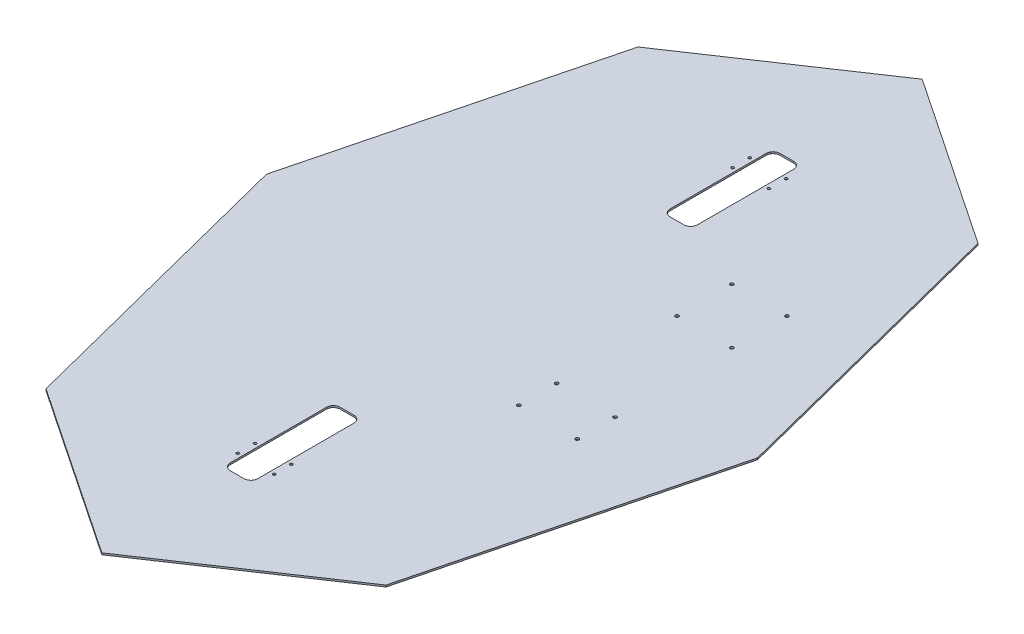
from build123d import *

# Parameters (mm, degrees)
BOSS_EXTRUDE1_DEPTH  = 1.5875
SKETCH2_W            = 50.8
SKETCH2_H            = 203.2
SKETCH2_R            = 2.54
CUT_EXTRUDE1_DEPTH   = 884.673339516
FILLET1_R            = 12.7
CUT_EXTRUDE3_REACH   = 885.678
SKETCH4_R            = 3.175
FILLET1_OF_MIRROR1_R = 12.7


with BuildPart() as part:
    # Sketch1 → Boss-Extrude1 (new, symmetric)
    with BuildSketch(Plane(origin=(0, 0, 0), x_dir=(1, 0, 0), z_dir=(0, 1, 0))):
        Polygon((-314.234696616, 547.119578242), (-453.923150307, 0), (-314.234696616, -547.119578242), (0, -758.175325655), (314.234696616, -547.119578242), (453.923150307, 0), (314.234696616, 547.119578242), (0, 758.175325655), align=None)
    extrude(amount=BOSS_EXTRUDE1_DEPTH, both=True)

    # Sketch2 → Cut-Extrude1 (cut, symmetric)
    with BuildSketch(Plane(origin=(0, 0, 0), x_dir=(1, 0, 0), z_dir=(0, 1, 0))):
        with Locations((0, 406.4)):
            Rectangle(SKETCH2_W, SKETCH2_H)
        with Locations((-33.528, 473.075)):
            Circle(SKETCH2_R)
        with Locations((-33.528, 441.325)):
            Circle(SKETCH2_R)
        with Locations((33.528, 441.325)):
            Circle(SKETCH2_R)
        with Locations((33.528, 473.075)):
            Circle(SKETCH2_R)
    cut_extrude1 = extrude(amount=CUT_EXTRUDE1_DEPTH, both=True, mode=Mode.SUBTRACT)

    # Fillet1
    fillet1_edges = [part.edges().sort_by_distance(p)[0] for p in [
        (-25.4, 0, -508),
        (25.4, 0, -508),
        (25.4, 0, -304.8),
        (-25.4, 0, -304.8),
    ]]
    fillet(fillet1_edges, radius=FILLET1_R)

    # Sketch4 → Cut-Extrude3 (cut, up to next)
    with BuildSketch(Plane(origin=(0, 1.5875, 0), x_dir=(1, 0, 0), z_dir=(0, 1, 0)), mode=Mode.PRIVATE) as cut_extrude3_sk1:
        with Locations((257.175, -66.675)):
            Circle(SKETCH4_R)
    cut_extrude3_tool1 = extrude(cut_extrude3_sk1.sketch, amount=-CUT_EXTRUDE3_REACH, mode=Mode.PRIVATE) & part.part
    # Sketch4 → Cut-Extrude3 (cut, up to next)
    with BuildSketch(Plane(origin=(0, 1.5875, 0), x_dir=(1, 0, 0), z_dir=(0, 1, 0)), mode=Mode.PRIVATE) as cut_extrude3_sk2:
        with Locations((149.225, -66.675)):
            Circle(SKETCH4_R)
    cut_extrude3_tool2 = extrude(cut_extrude3_sk2.sketch, amount=-CUT_EXTRUDE3_REACH, mode=Mode.PRIVATE) & part.part
    # Sketch4 → Cut-Extrude3 (cut, up to next)
    with BuildSketch(Plane(origin=(0, 1.5875, 0), x_dir=(1, 0, 0), z_dir=(0, 1, 0)), mode=Mode.PRIVATE) as cut_extrude3_sk3:
        with Locations((149.225, -136.525)):
            Circle(SKETCH4_R)
    cut_extrude3_tool3 = extrude(cut_extrude3_sk3.sketch, amount=-CUT_EXTRUDE3_REACH, mode=Mode.PRIVATE) & part.part
    # Sketch4 → Cut-Extrude3 (cut, up to next)
    with BuildSketch(Plane(origin=(0, 1.5875, 0), x_dir=(1, 0, 0), z_dir=(0, 1, 0)), mode=Mode.PRIVATE) as cut_extrude3_sk4:
        with Locations((257.175, -136.525)):
            Circle(SKETCH4_R)
    cut_extrude3_tool4 = extrude(cut_extrude3_sk4.sketch, amount=-CUT_EXTRUDE3_REACH, mode=Mode.PRIVATE) & part.part
    # Sketch4 → Cut-Extrude3 (cut, up to next)
    with BuildSketch(Plane(origin=(0, 1.5875, 0), x_dir=(1, 0, 0), z_dir=(0, 1, 0)), mode=Mode.PRIVATE) as cut_extrude3_sk5:
        with Locations((152.4, 254)):
            Circle(SKETCH4_R)
    cut_extrude3_tool5 = extrude(cut_extrude3_sk5.sketch, amount=-CUT_EXTRUDE3_REACH, mode=Mode.PRIVATE) & part.part
    # Sketch4 → Cut-Extrude3 (cut, up to next)
    with BuildSketch(Plane(origin=(0, 1.5875, 0), x_dir=(1, 0, 0), z_dir=(0, 1, 0)), mode=Mode.PRIVATE) as cut_extrude3_sk6:
        with Locations((254, 254)):
            Circle(SKETCH4_R)
    cut_extrude3_tool6 = extrude(cut_extrude3_sk6.sketch, amount=-CUT_EXTRUDE3_REACH, mode=Mode.PRIVATE) & part.part
    # Sketch4 → Cut-Extrude3 (cut, up to next)
    with BuildSketch(Plane(origin=(0, 1.5875, 0), x_dir=(1, 0, 0), z_dir=(0, 1, 0)), mode=Mode.PRIVATE) as cut_extrude3_sk7:
        with Locations((254, 152.4)):
            Circle(SKETCH4_R)
    cut_extrude3_tool7 = extrude(cut_extrude3_sk7.sketch, amount=-CUT_EXTRUDE3_REACH, mode=Mode.PRIVATE) & part.part
    # Sketch4 → Cut-Extrude3 (cut, up to next)
    with BuildSketch(Plane(origin=(0, 1.5875, 0), x_dir=(1, 0, 0), z_dir=(0, 1, 0)), mode=Mode.PRIVATE) as cut_extrude3_sk8:
        with Locations((152.4, 152.4)):
            Circle(SKETCH4_R)
    cut_extrude3_tool8 = extrude(cut_extrude3_sk8.sketch, amount=-CUT_EXTRUDE3_REACH, mode=Mode.PRIVATE) & part.part
    add(cut_extrude3_tool1.solids().sort_by_distance((257.175, 1.5875, 66.675))[0], mode=Mode.SUBTRACT)
    add(cut_extrude3_tool2.solids().sort_by_distance((149.225, 1.5875, 66.675))[0], mode=Mode.SUBTRACT)
    add(cut_extrude3_tool3.solids().sort_by_distance((149.225, 1.5875, 136.525))[0], mode=Mode.SUBTRACT)
    add(cut_extrude3_tool4.solids().sort_by_distance((257.175, 1.5875, 136.525))[0], mode=Mode.SUBTRACT)
    add(cut_extrude3_tool5.solids().sort_by_distance((152.4, 1.5875, -254))[0], mode=Mode.SUBTRACT)
    add(cut_extrude3_tool6.solids().sort_by_distance((254, 1.5875, -254))[0], mode=Mode.SUBTRACT)
    add(cut_extrude3_tool7.solids().sort_by_distance((254, 1.5875, -152.4))[0], mode=Mode.SUBTRACT)
    add(cut_extrude3_tool8.solids().sort_by_distance((152.4, 1.5875, -152.4))[0], mode=Mode.SUBTRACT)

    # Mirror1: Cut-Extrude1 across plane
    add(cut_extrude1.mirror(Plane.XY), mode=Mode.SUBTRACT)

    # Fillet1 of Mirror1
    fillet1_of_mirror1_edges = [part.edges().sort_by_distance(p)[0] for p in [
        (-25.4, 0, 508),
        (25.4, 0, 508),
        (25.4, 0, 304.8),
        (-25.4, 0, 304.8),
    ]]
    fillet(fillet1_of_mirror1_edges, radius=FILLET1_OF_MIRROR1_R)


solid = part.part
